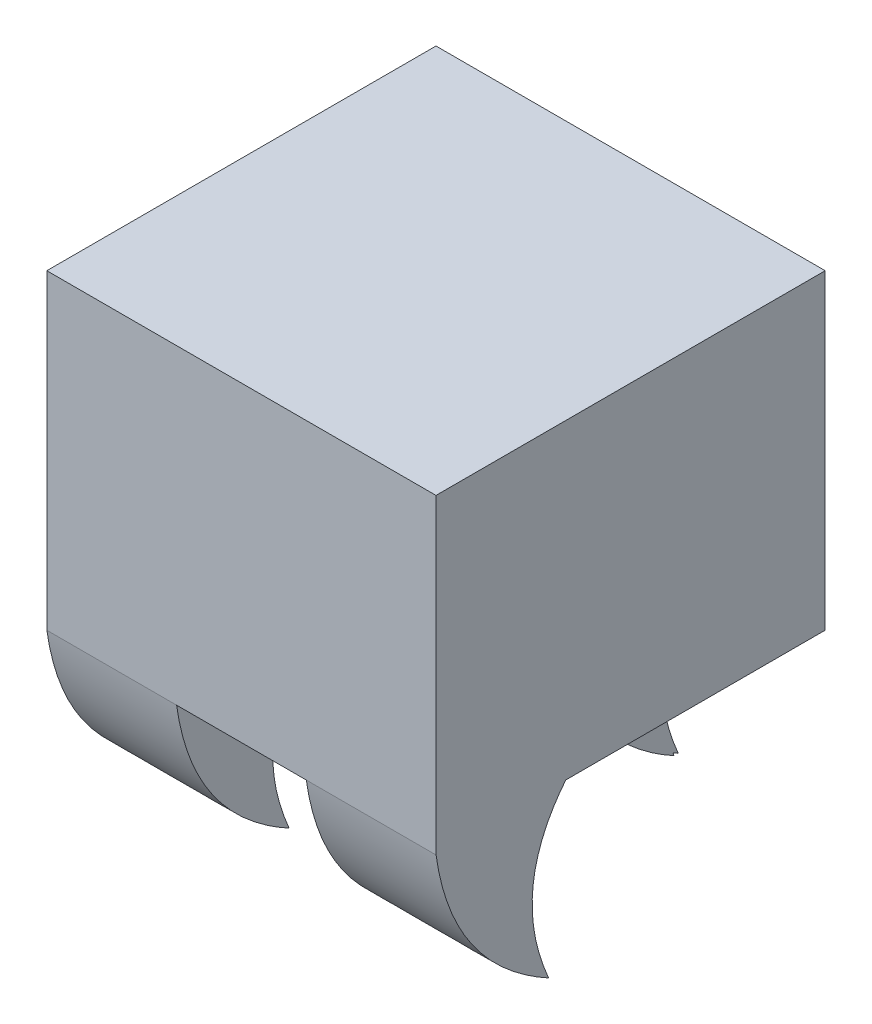
from build123d import *

# Parameters (mm, degrees)
SKETCH_1_W               = 15
SKETCH_1_H               = 15
EXTRUDE_1_DEPTH          = 6
EXTRUDE_2_DEPTH          = 2.5
PATTERN_START            = -7.5
PATTERN_SKETCH_2_DEPTH   = 5
PATTERN_START_2          = 2.5
PATTERN_SKETCH_2_2_DEPTH = 5
PATTERN_START_3          = -2.5
PATTERN_SKETCH_2_3_DEPTH = 5


# Read off the part's stored shape, not the designer's step: 스케치 패턴2
with BuildPart() as part:
    # 스케치1 → 보스-돌출1 (new, symmetric)
    with BuildSketch(Plane(origin=(0, 0, 0), x_dir=(1, 0, 0), z_dir=(0, 1, 0))):
        Rectangle(SKETCH_1_W, SKETCH_1_H)
    extrude(amount=EXTRUDE_1_DEPTH, both=True)

    # 스케치3 → 보스-돌출2 (add, symmetric)
    with BuildSketch(Plane(origin=(0, 0, 0), x_dir=(0, 0, -1), z_dir=(1, 0, 0))):
        with BuildLine():
            Line((2.5, -6), (7.5, -6))
            add(Edge.make_bspline(
                [(6.837946582, -12.278081575), (5.299376428, -8.730527415), (7.5, -6)],
                knots=[0, 0, 0, 1, 1, 1], degree=2))
            add(Edge.make_bspline(
                [(2.5, -6), (3.098107293, -10.225865232), (6.837946582, -12.278081575)],
                knots=[0, 0, 0, 1, 1, 1], degree=2))
        make_face()
    extrude(amount=EXTRUDE_2_DEPTH, both=True)

    # 스케치 패턴2 outline → 스케치 패턴2 (add)
    with BuildSketch(Plane.YZ.offset(PATTERN_START)):
        with BuildLine():
            add(Edge.make_bspline(
                [(-12.278081575, 3.16045553), (-8.730527415, 4.699025684), (-6, 2.498402112)],
                knots=[0, 0, 0, 1, 1, 1], degree=2))
            Line((-6, 2.498402112), (-6, 7.498402112))
            add(Edge.make_bspline(
                [(-6, 7.498402112), (-10.225865232, 6.900294818), (-12.278081575, 3.16045553)],
                knots=[0, 0, 0, 1, 1, 1], degree=2))
        make_face()
    extrude(amount=PATTERN_SKETCH_2_DEPTH)

    # Pattern Sketch 2 2 outline → Pattern Sketch 2 2 (add)
    with BuildSketch(Plane.YZ.offset(PATTERN_START_2)):
        with BuildLine():
            add(Edge.make_bspline(
                [(-12.278081575, 3.16045553), (-8.730527415, 4.699025684), (-6, 2.498402112)],
                knots=[0, 0, 0, 1, 1, 1], degree=2))
            Line((-6, 2.498402112), (-6, 7.498402112))
            add(Edge.make_bspline(
                [(-6, 7.498402112), (-10.225865232, 6.900294818), (-12.278081575, 3.16045553)],
                knots=[0, 0, 0, 1, 1, 1], degree=2))
        make_face()
    extrude(amount=PATTERN_SKETCH_2_2_DEPTH)

    # Pattern Sketch 2 3 outline → Pattern Sketch 2 3 (add)
    with BuildSketch(Plane.YZ.offset(PATTERN_START_3)):
        with BuildLine():
            add(Edge.make_bspline(
                [(-6, -2.341597888), (-10.225865232, -2.939705182), (-12.278081575, -6.67954447)],
                knots=[0, 0, 0, 1, 1, 1], degree=2))
            add(Edge.make_bspline(
                [(-12.278081575, -6.67954447), (-12.219236087, -6.65402325), (-12.160615404, -6.629530866)],
                knots=[0, 0, 0, 0.016587622, 0.016587622, 0.016587622], degree=2))
            add(Edge.make_bspline(
                [(-6, -2.5), (-10.106703233, -3.081241715), (-12.160615404, -6.629530866)],
                knots=[0, 0, 0, 0.971801751, 0.971801751, 0.971801751], degree=2))
            Line((-6, -2.5), (-6, -2.341597888))
        make_face()
    extrude(amount=PATTERN_SKETCH_2_3_DEPTH)


solid = part.part
